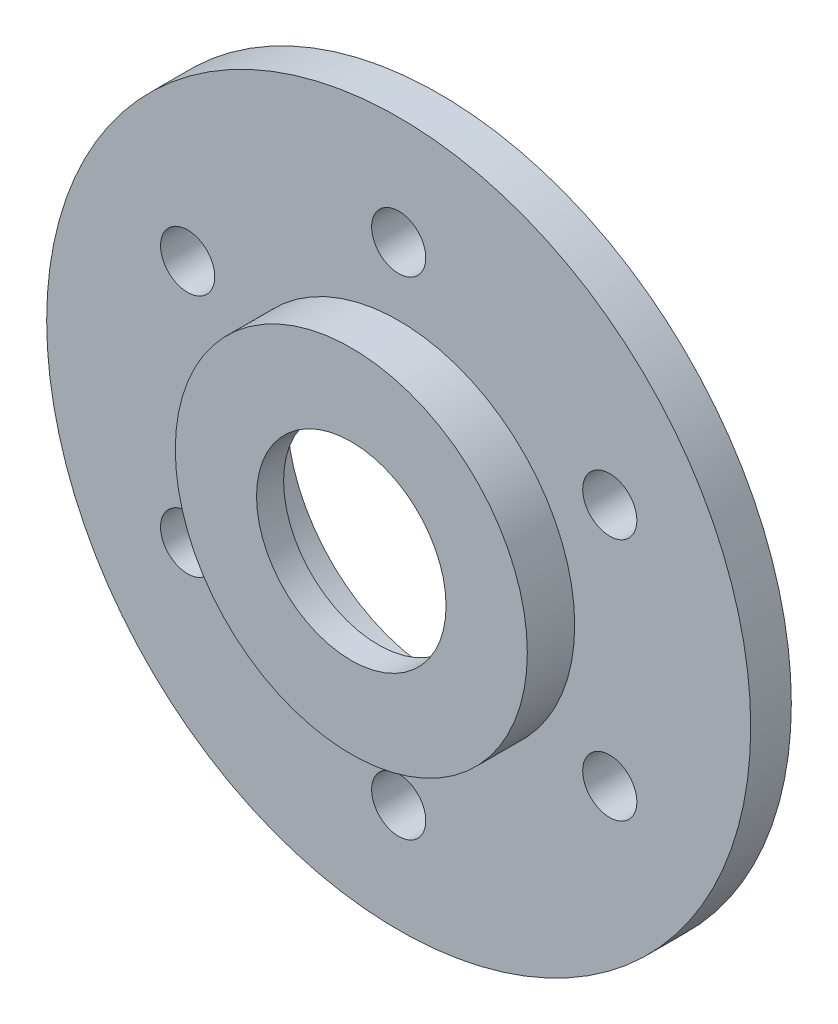
from build123d import *

# Parameters (mm, degrees)
CROQUIS1_R              = 13
CROQUIS1_R_2            = 7
SALIENTE_EXTRUIR1_DEPTH = 4
CROQUIS2_R              = 26
CROQUIS2_R_2            = 11.25
SALIENTE_EXTRUIR2_DEPTH = 1.5
CROQUIS3_R              = 2
CORTAR_EXTRUIR1_DEPTH   = 38.17862289
CROQUIS4_R              = 11.25
CORTAR_EXTRUIR2_DEPTH   = 4.5
CROQUIS5_R              = 13
CROQUIS5_R_2            = 7
SALIENTE_EXTRUIR3_DEPTH = 1


with BuildPart() as part:
    # Croquis1 → Saliente-Extruir1 (new body)
    with BuildSketch(Plane.XY):
        Circle(CROQUIS1_R)
        Circle(CROQUIS1_R_2, mode=Mode.SUBTRACT)
    extrude(amount=SALIENTE_EXTRUIR1_DEPTH)

    # Croquis4 → Cortar-Extruir2 (cut)
    with BuildSketch(Plane(origin=(0, 0, -1.5), x_dir=(-1, 0, 0), z_dir=(0, 0, -1))):
        Circle(CROQUIS4_R)
    extrude(amount=-CORTAR_EXTRUIR2_DEPTH, mode=Mode.SUBTRACT)

    # Croquis5 → Saliente-Extruir3 (add)
    with BuildSketch(Plane.XY.offset(4)):
        Circle(CROQUIS5_R)
        Circle(CROQUIS5_R_2, mode=Mode.SUBTRACT)
    extrude(amount=SALIENTE_EXTRUIR3_DEPTH)


with BuildPart() as body_2:
    # Croquis2 → Saliente-Extruir2 (new, symmetric)
    with BuildSketch(Plane(origin=(0, 0, 0), x_dir=(-1, 0, 0), z_dir=(0, 0, -1))):
        Circle(CROQUIS2_R)
        Circle(CROQUIS2_R_2, mode=Mode.SUBTRACT)
    extrude(amount=SALIENTE_EXTRUIR2_DEPTH, both=True)

    # Croquis3 → Cortar-Extruir1 (cut, through all)
    with BuildSketch(Plane(origin=(0, 0, -1.5), x_dir=(-1, 0, 0), z_dir=(0, 0, -1))):
        with Locations((0, 18)):
            Circle(CROQUIS3_R)
        with Locations((15.588457268, 9)):
            Circle(CROQUIS3_R)
        with Locations((15.588457268, -9)):
            Circle(CROQUIS3_R)
        with Locations((0, -18)):
            Circle(CROQUIS3_R)
        with Locations((-15.588457268, -9)):
            Circle(CROQUIS3_R)
        with Locations((-15.588457268, 9)):
            Circle(CROQUIS3_R)
    extrude(amount=-CORTAR_EXTRUIR1_DEPTH, mode=Mode.SUBTRACT)


solid = Compound([part.part, body_2.part])
